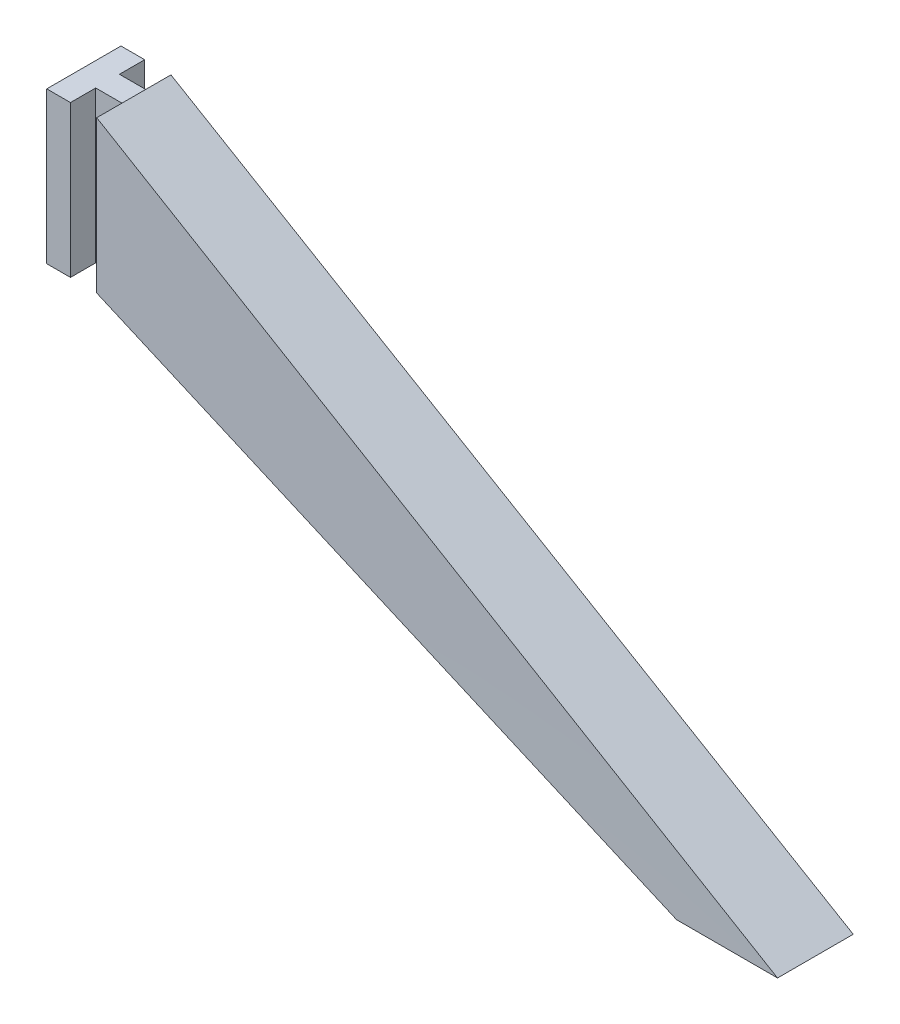
from build123d import *

# Parameters (mm, degrees)
BOSS_EXTRUDE1_DEPTH = 30


with BuildPart() as part:
    # Sketch2 → Boss-Extrude1 (new body)
    with BuildSketch(Plane(origin=(0, 0, 0), x_dir=(1, 0, 0), z_dir=(0, 1, 0))):
        Polygon((-9.9, 7.35), (-9.9, -7.35), (-5.2, -7.35), (-5.2, -2.35), (0, -2.35), (0, 2.35), (-5.2, 2.35), (-5.2, 7.35), align=None)
    extrude(amount=BOSS_EXTRUDE1_DEPTH)

    # Sketch6 → Loft2 section 0
    with BuildSketch(Plane(origin=(0, 0, 0), x_dir=(0, 0, -1), z_dir=(1, 0, 0))):
        with BuildLine():
            Line((-7.35, 30), (7.35, 30))
            Line((7.35, 30), (7.35, -0.074844552))
            Line((7.35, -0.074844552), (-7.35, -0.074844552))
            Line((-7.35, -0.074844552), (-7.35, 30))
        make_face()
    # Sketch5 → Loft2 section 1
    with BuildSketch(Plane(origin=(0, -50, 0), x_dir=(-1, 0, 0), z_dir=(0, 1, 0))):
        with BuildLine():
            Line((-135, 7.5), (-115, 7.5))
            Line((-115, 7.5), (-115, -7.5))
            Line((-115, -7.5), (-135, -7.5))
            Line((-135, -7.5), (-135, 7.5))
        make_face()
    loft()


solid = part.part
